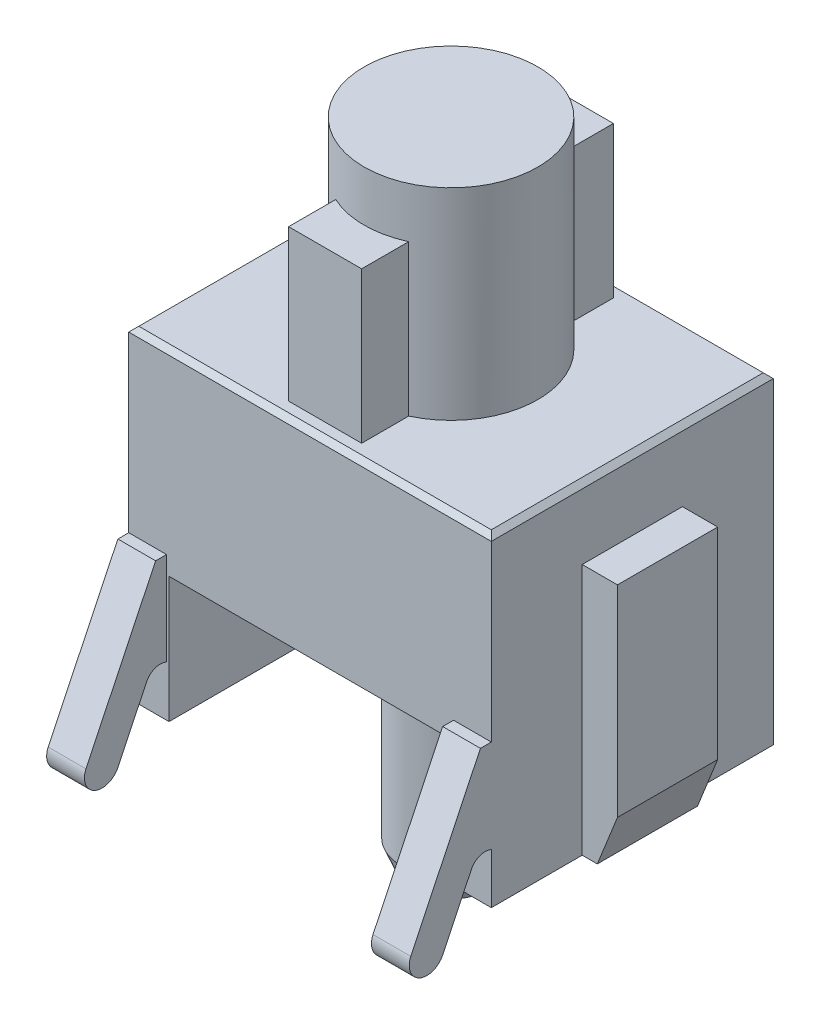
from build123d import *

# Parameters (mm, degrees)
SKETCH1_W                = 7.2
SKETCH1_H                = 5.6
BODY_DEPTH               = 6.4
BODY_CHAMFER_SIZE        = 0.1
SKETCH2_R                = 1.725
MOUNT_DEPTH              = 4
SKETCH3_W                = 1.45
SKETCH3_H                = 5
MOUNT_RAILS_DEPTH        = 3
SKETCH4_R                = 2.25
BODY_CUT_1_DEPTH         = 4.8
SKETCH5_W                = 5.6
SKETCH5_H                = 5.6
BODY_CUT_2_DEPTH         = 2.5
SKETCH6_R                = 0.975
POLE_DEPTH               = 7.3
POLE_CHAMFER_SIZE        = 0.5
POLE_CHAMFER_SIZE2       = 0.2
SKETCH7_W                = 1.99
SKETCH7_H                = 5
RIGHT_RAIL_DEPTH         = 0.7
RIGHT_RAIL_CHAMFER_SIZE  = 0.4
RIGHT_RAIL_CHAMFER_SIZE2 = 1
LEFT_RAIL_CHAMFER_SIZE   = 1
LEFT_RAIL_CHAMFER_SIZE2  = 0.4
RIGHT_LEG_DEPTH          = 0.75


with BuildPart() as part:
    # Sketch1 → Body (new body)
    with BuildSketch(Plane(origin=(0, 0, 0), x_dir=(1, 0, 0), z_dir=(0, 1, 0))):
        Rectangle(SKETCH1_W, SKETCH1_H)
    extrude(amount=BODY_DEPTH)

    # Body Chamfer
    body_chamfer_edges = [part.edges().sort_by_distance(p)[0] for p in [
        (0, 6.4, 2.8),
        (3.6, 6.4, 0),
        (0, 6.4, -2.8),
        (-3.6, 6.4, 0),
    ]]
    chamfer(body_chamfer_edges, length=BODY_CHAMFER_SIZE)

    # Sketch2 → Mount (add)
    with BuildSketch(Plane(origin=(0, 6.4, 0), x_dir=(1, 0, 0), z_dir=(0, 1, 0))):
        Circle(SKETCH2_R)
    extrude(amount=MOUNT_DEPTH)

    # Sketch3 → Mount Rails (add)
    with BuildSketch(Plane(origin=(0, 6.4, 0), x_dir=(1, 0, 0), z_dir=(0, 1, 0))):
        Rectangle(SKETCH3_W, SKETCH3_H)
    extrude(amount=MOUNT_RAILS_DEPTH)

    # Sketch4 → Body Cut 1 (cut)
    with BuildSketch(Plane.XZ):
        Circle(SKETCH4_R)
    extrude(amount=-BODY_CUT_1_DEPTH, mode=Mode.SUBTRACT)

    # Sketch5 → Body Cut 2 (cut)
    with BuildSketch(Plane.XZ):
        Rectangle(SKETCH5_W, SKETCH5_H)
    extrude(amount=-BODY_CUT_2_DEPTH, mode=Mode.SUBTRACT)

    # Sketch6 → Pole (add)
    with BuildSketch(Plane.XZ.offset(-4.8)):
        Circle(SKETCH6_R)
    extrude(amount=POLE_DEPTH)

    # Pole Chamfer
    pole_chamfer_edges = [part.edges().sort_by_distance(p)[0] for p in [
        (-0.975, -2.5, 0),
    ]]
    pole_chamfer_side = [part.faces().sort_by_distance(p)[0] for p in [
        (-0.975, 1.15, 0),
    ]]
    chamfer(pole_chamfer_edges, length=POLE_CHAMFER_SIZE, length2=POLE_CHAMFER_SIZE2, reference=pole_chamfer_side[0])

    # Sketch7 → Right Rail (add)
    with BuildSketch(Plane(origin=(3.6, 0, 0), x_dir=(0, 0, -1), z_dir=(1, 0, 0))):
        with Locations((0, 2.5)):
            Rectangle(SKETCH7_W, SKETCH7_H)
    right_rail = extrude(amount=RIGHT_RAIL_DEPTH)

    # Rail Mirror: Right Rail across plane
    add(right_rail.mirror(Plane(origin=(0, 0, 0), x_dir=(0, 0, 1), z_dir=(1, 0, 0))))

    # Right Rail Chamfer
    right_rail_chamfer_edges = [part.edges().sort_by_distance(p)[0] for p in [
        (4.3, 0, 0),
    ]]
    right_rail_chamfer_side = [part.faces().sort_by_distance(p)[0] for p in [
        (3.377890346, 0, 0),
    ]]
    chamfer(right_rail_chamfer_edges, length=RIGHT_RAIL_CHAMFER_SIZE, length2=RIGHT_RAIL_CHAMFER_SIZE2, reference=right_rail_chamfer_side[0])

    # Left Rail Chamfer
    left_rail_chamfer_edges = [part.edges().sort_by_distance(p)[0] for p in [
        (-4.3, 0, 0),
    ]]
    left_rail_chamfer_side = [part.faces().sort_by_distance(p)[0] for p in [
        (-4.3, 2.5, 0),
    ]]
    chamfer(left_rail_chamfer_edges, length=LEFT_RAIL_CHAMFER_SIZE, length2=LEFT_RAIL_CHAMFER_SIZE2, reference=left_rail_chamfer_side[0])

    # Sketch8 → Right Leg (add)
    with BuildSketch(Plane(origin=(3.6, 0, 0), x_dir=(0, 0, -1), z_dir=(1, 0, 0))):
        with BuildLine():
            Line((-3.016216216, 2.849166829), (-4.4, -0.036165464))
            ThreePointArc((-4.4, -0.036165464), (-4.221723875, -0.497920402), (-3.759968937, -0.319644277))
            Line((-3.759968937, -0.319644277), (-3.197806774, 0.852521967))
            ThreePointArc((-3.197806774, 0.852521967), (-3.029447088, 1.008649464), (-2.8, 1))
            Line((-2.8, 1), (-2.8, 2.849166829))
            Line((-2.8, 2.849166829), (-3.016216216, 2.849166829))
        make_face()
    right_leg = extrude(amount=-RIGHT_LEG_DEPTH)

    # Leg Mirror: Right Leg across plane
    add(right_leg.mirror(Plane(origin=(0, 0, 0), x_dir=(0, 0, 1), z_dir=(1, 0, 0))))


solid = part.part
